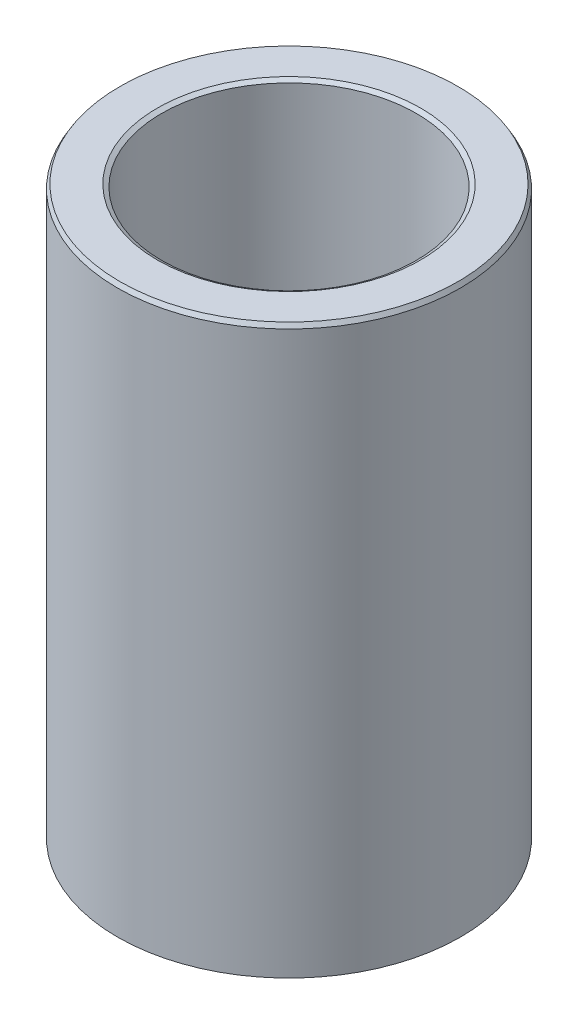
from build123d import *
from OCP.BRepFilletAPI import BRepFilletAPI_MakeChamfer

# Parameters (mm, degrees)
SKETCH1_R           = 30
BOSS_EXTRUDE1_DEPTH = 99.492693561
SKETCH2_R           = 22.275473765
CUT_EXTRUDE1_DEPTH  = 109.160972962
CHAMFER1_SIZE       = 0.750340119
CHAMFER1_SIZE2      = 0.43320907


with BuildPart() as part:
    # Sketch1 → Boss-Extrude1 (new body)
    with BuildSketch(Plane(origin=(0, 0, 0), x_dir=(1, 0, 0), z_dir=(0, 1, 0))):
        Circle(SKETCH1_R)
    extrude(amount=BOSS_EXTRUDE1_DEPTH)

    # Sketch2 → Cut-Extrude1 (cut, through all)
    with BuildSketch(Plane(origin=(0, 0, 0), x_dir=(1, 0, 0), z_dir=(0, 1, 0))):
        Circle(SKETCH2_R)
    extrude(amount=CUT_EXTRUDE1_DEPTH, mode=Mode.SUBTRACT)

    # Chamfer1: one chamfer whose edges measure the first distance from different faces: ONE call of the kernel's chamfer builder (chamfer() names one face for all edges)
    chamfer1_edges_1 = [part.edges().sort_by_distance(p)[0] for p in [
        (-22.275473765, 99.492693561, 0),
    ]]
    chamfer1_side_1 = [part.faces().sort_by_distance(p)[0] for p in [
        (-29.151471863, 99.492693561, 0),
    ]]
    chamfer1_edges_2 = [part.edges().sort_by_distance(p)[0] for p in [
        (-22.275473765, 0, 0),
    ]]
    chamfer1_side_2 = [part.faces().sort_by_distance(p)[0] for p in [
        (-22.275473765, 49.746346781, 0),
    ]]
    chamfer1_edges_3 = [part.edges().sort_by_distance(p)[0] for p in [
        (-30, 0, 0),
    ]]
    chamfer1_side_3 = [part.faces().sort_by_distance(p)[0] for p in [
        (-29.151471863, 0, 0),
    ]]
    chamfer1_edges_4 = [part.edges().sort_by_distance(p)[0] for p in [
        (-30, 99.492693561, 0),
    ]]
    chamfer1_side_4 = [part.faces().sort_by_distance(p)[0] for p in [
        (-30, 49.746346781, 0),
    ]]
    chamfer1 = BRepFilletAPI_MakeChamfer(part.part.solid().wrapped)
    for e in chamfer1_edges_1:
        chamfer1.Add(CHAMFER1_SIZE, CHAMFER1_SIZE2, e.wrapped, chamfer1_side_1[0].wrapped)  # the first distance lies on this face
    for e in chamfer1_edges_2:
        chamfer1.Add(CHAMFER1_SIZE, CHAMFER1_SIZE2, e.wrapped, chamfer1_side_2[0].wrapped)  # the first distance lies on this face
    for e in chamfer1_edges_3:
        chamfer1.Add(CHAMFER1_SIZE, CHAMFER1_SIZE2, e.wrapped, chamfer1_side_3[0].wrapped)  # the first distance lies on this face
    for e in chamfer1_edges_4:
        chamfer1.Add(CHAMFER1_SIZE, CHAMFER1_SIZE2, e.wrapped, chamfer1_side_4[0].wrapped)  # the first distance lies on this face
    add(Compound.cast(chamfer1.Shape()), mode=Mode.REPLACE)


solid = part.part
